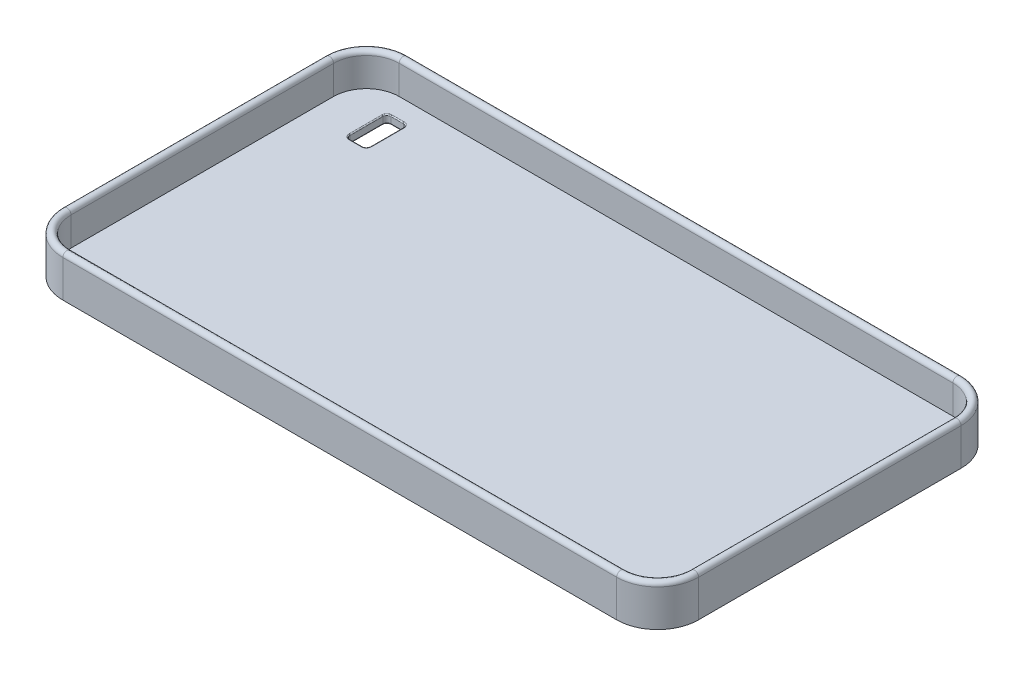
from build123d import *

# Parameters (mm, degrees)
SKETCH1_W           = 155
SKETCH1_H           = 84
BOSS_EXTRUDE1_DEPTH = 10
FILLET1_R           = 10
SHELL1_T            = -2
SKETCH2_W           = 5
SKETCH2_H           = 10
CUT_EXTRUDE1_DEPTH  = 89.511298714
FILLET2_R           = 1
FILLET3_R           = 0.25
FILLET4_R           = 1


with BuildPart() as part:
    # Sketch1 → Boss-Extrude1 (new body)
    with BuildSketch(Plane(origin=(0, 0, 0), x_dir=(1, 0, 0), z_dir=(0, 1, 0))):
        Rectangle(SKETCH1_W, SKETCH1_H)
    extrude(amount=BOSS_EXTRUDE1_DEPTH)

    # Fillet1
    fillet1_edges = [part.edges().sort_by_distance(p)[0] for p in [
        (77.5, 5, 42),
        (-77.5, 5, 42),
        (-77.5, 5, -42),
        (77.5, 5, -42),
    ]]
    fillet(fillet1_edges, radius=FILLET1_R)

    # Shell1
    shell1_openings = [part.faces().sort_by_distance(p)[0] for p in [
        (0, 10, 0),
    ]]
    offset(amount=SHELL1_T, openings=shell1_openings, kind=Kind.INTERSECTION)

    # Sketch2 → Cut-Extrude1 (cut, through all)
    with BuildSketch(Plane(origin=(0, 2, 0), x_dir=(1, 0, 0), z_dir=(0, 1, 0))):
        with Locations((-63, 30)):
            Rectangle(SKETCH2_W, SKETCH2_H)
    extrude(amount=-CUT_EXTRUDE1_DEPTH, mode=Mode.SUBTRACT)

    # Fillet2
    fillet2_edges = [part.edges().sort_by_distance(p)[0] for p in [
        (-60.5, 1, -35),
        (-60.5, 1, -25),
        (-65.5, 1, -25),
        (-65.5, 1, -35),
    ]]
    fillet(fillet2_edges, radius=FILLET2_R)

    # Fillet3
    fillet3_edges = [part.edges().sort_by_distance(p)[0] for p in [
        (-60.5, 2, -30),
        (-60.5, 0, -30),
        (-63, 2, -25),
        (-63, 0, -25),
        (-65.5, 2, -30),
        (-65.5, 0, -30),
        (-63, 2, -35),
        (-63, 0, -35),
        (-60.792893219, 2, -25.292893219),
        (-60.792893219, 0, -25.292893219),
        (-65.207106781, 2, -25.292893219),
        (-65.207106781, 0, -25.292893219),
        (-65.207106781, 2, -34.707106781),
        (-65.207106781, 0, -34.707106781),
        (-60.792893219, 2, -34.707106781),
        (-60.792893219, 0, -34.707106781),
    ]]
    fillet(fillet3_edges, radius=FILLET3_R)

    # Fillet4
    fillet4_edges = [part.edges().sort_by_distance(p)[0] for p in [
        (0, 10, 42),
        (-77.5, 10, 0),
        (77.5, 10, 0),
        (0, 10, -42),
        (74.571067812, 10, 39.071067812),
        (74.571067812, 10, -39.071067812),
        (-74.571067812, 10, -39.071067812),
        (-74.571067812, 10, 39.071067812),
        (-75.5, 10, 0),
        (0, 10, 40),
        (75.5, 10, 0),
        (0, 10, -40),
    ]]
    fillet(fillet4_edges, radius=FILLET4_R - 0.0001)  # a hair under: the kernel refuses the full size


solid = part.part
